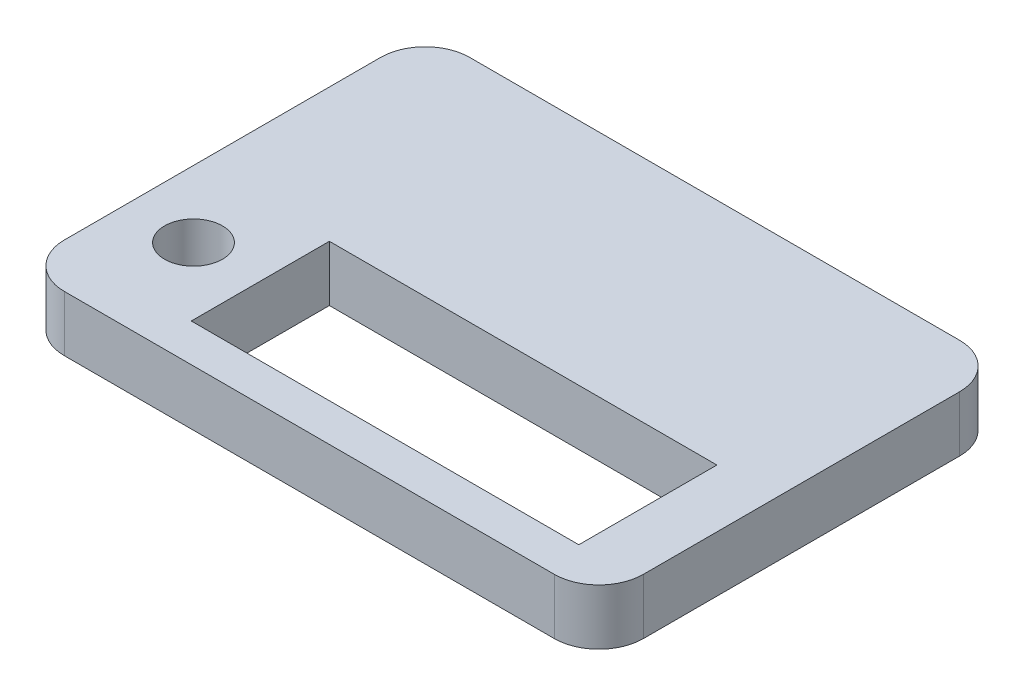
from build123d import *

# Parameters (mm, degrees)
SKETCH1_W           = 33.02
SKETCH1_H           = 23.114
BOSS_EXTRUDE1_DEPTH = 3.175
SKETCH2_R           = 1.651
CUT_EXTRUDE1_DEPTH  = 21.401592438
SKETCH3_W           = 22.098
SKETCH3_H           = 7.874
CUT_EXTRUDE2_DEPTH  = 21.401592438
FILLET1_R           = 2.54


with BuildPart() as part:
    # Sketch1 → Boss-Extrude1 (new body)
    with BuildSketch(Plane(origin=(0, 0, 0), x_dir=(1, 0, 0), z_dir=(0, 1, 0))):
        Rectangle(SKETCH1_W, SKETCH1_H)
    extrude(amount=BOSS_EXTRUDE1_DEPTH)

    # Sketch2 → Cut-Extrude1 (cut, through all)
    with BuildSketch(Plane(origin=(0, 3.175, 0), x_dir=(1, 0, 0), z_dir=(0, 1, 0))):
        with Locations((-12.7, -5.461)):
            Circle(SKETCH2_R)
    extrude(amount=-CUT_EXTRUDE1_DEPTH, mode=Mode.SUBTRACT)

    # Sketch3 → Cut-Extrude2 (cut, through all)
    with BuildSketch(Plane(origin=(0, 3.175, 0), x_dir=(1, 0, 0), z_dir=(0, 1, 0))):
        with Locations((2.159, -5.461)):
            Rectangle(SKETCH3_W, SKETCH3_H)
    extrude(amount=-CUT_EXTRUDE2_DEPTH, mode=Mode.SUBTRACT)

    # Fillet1
    fillet1_edges = [part.edges().sort_by_distance(p)[0] for p in [
        (16.51, 1.5875, -11.557),
        (16.51, 1.5875, 11.557),
        (-16.51, 1.5875, 11.557),
        (-16.51, 1.5875, -11.557),
    ]]
    fillet(fillet1_edges, radius=FILLET1_R)


solid = part.part
